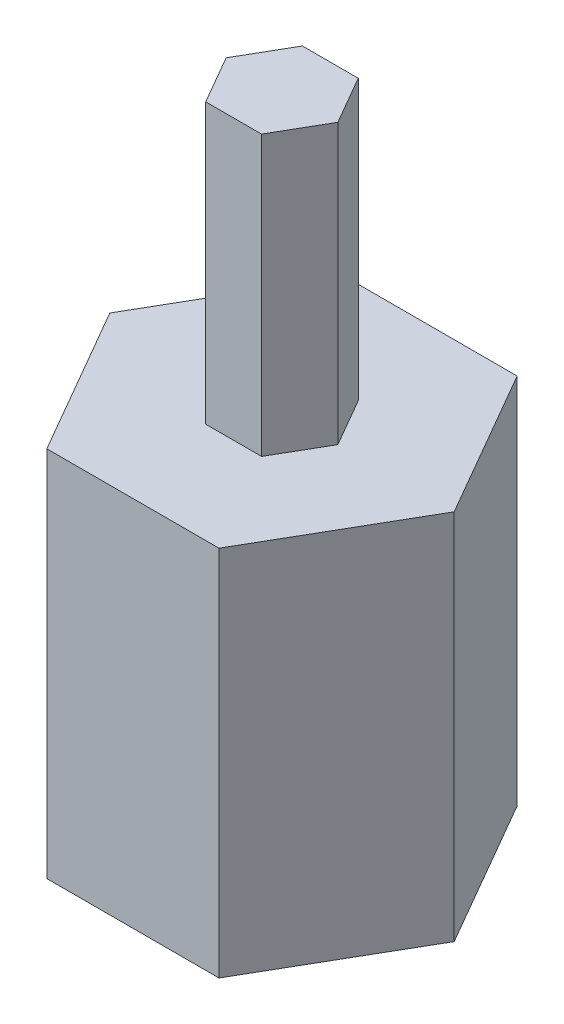
from build123d import *

# Parameters (mm, degrees)
BOSS_EXTRUDE1_DEPTH = 6
BOSS_EXTRUDE2_DEPTH = 8


with BuildPart() as part:
    # Sketch1 → Boss-Extrude1 (new body)
    with BuildSketch(Plane(origin=(0, 0, 0), x_dir=(1, 0, 0), z_dir=(0, 1, 0))):
        Polygon((1.2, 0), (0.6, 1.039230485), (-0.6, 1.039230485), (-1.2, 0), (-0.6, -1.039230485), (0.6, -1.039230485), align=None)
    extrude(amount=BOSS_EXTRUDE1_DEPTH)

    # Sketch2 → Boss-Extrude2 (add)
    with BuildSketch(Plane.XZ):
        Polygon((3.7, 0), (1.85, 3.204293994), (-1.85, 3.204293994), (-3.7, 0), (-1.85, -3.204293994), (1.85, -3.204293994), align=None)
    extrude(amount=BOSS_EXTRUDE2_DEPTH)


solid = part.part
